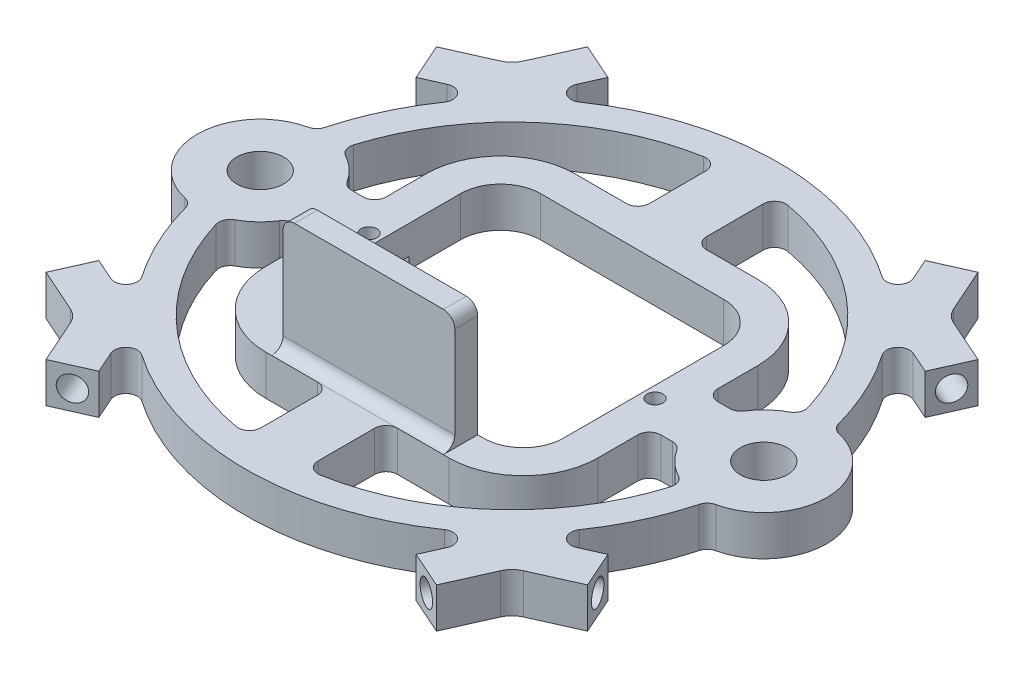
from build123d import *

# Parameters (mm, degrees)
BOSS_EXTRUDE1_DEPTH         = 4.445
SKETCH2_R                   = 5.207
BOSS_EXTRUDE2_DEPTH         = 4.445
BOSS_EXTRUDE3_DEPTH         = 4.445
BOSS_EXTRUDE4_DEPTH         = 4.445
FILLET1_R                   = 2.54
CUT_EXTRUDE1_DEPTH          = 2.54
CUT_EXTRUDE2_REACH          = 93.689
SKETCH7_R                   = 1.7526
SKETCH8_W                   = 38.1
SKETCH8_H                   = 5.08
EXTRUDE_THIN1_DEPTH         = 25.4
FILLET2_R                   = 2.54
BOSS_EXTRUDE6_DEPTH         = 8.89
SKETCH14_R                  = 2.7305
CUT_EXTRUDE3_DEPTH          = 10.16
FILLET3_R                   = 5.08
CIRPATTERN1_COUNT           = 4
CIRPATTERN1_COPY_1_SKETCH_R = 2.7305
CIRPATTERN1_COPY_1_DEPTH    = 10.16
CIRPATTERN1_COPY_2_SKETCH_R = 2.7305
CIRPATTERN1_COPY_2_DEPTH    = 10.16
CIRPATTERN1_COPY_3_SKETCH_R = 2.7305
CIRPATTERN1_COPY_3_DEPTH    = 10.16
FILLET3_OF_CIRPATTERN1_R    = 5.08


with BuildPart() as part:
    # Sketch1 → Boss-Extrude1 (new, symmetric)
    with BuildSketch(Plane(origin=(0, 0, 0), x_dir=(1, 0, 0), z_dir=(0, 1, 0))):
        with BuildLine():
            Line((-20.32, 34.29), (20.32, 34.29))
            ThreePointArc((20.32, 34.29), (31.994332957, 29.454332957), (36.83, 17.78))
            Line((36.83, 17.78), (36.83, -17.78))
            ThreePointArc((36.83, -17.78), (31.994332957, -29.454332957), (20.32, -34.29))
            Line((20.32, -34.29), (-20.32, -34.29))
            ThreePointArc((-20.32, -34.29), (-31.994332957, -29.454332957), (-36.83, -17.78))
            Line((-36.83, -17.78), (-36.83, 17.78))
            ThreePointArc((-36.83, 17.78), (-31.994332957, 29.454332957), (-20.32, 34.29))
        make_face()
        with BuildLine():
            Line((-20.32, 26.67), (20.32, 26.67))
            ThreePointArc((20.32, 26.67), (26.606179285, 24.066179285), (29.21, 17.78))
            Line((29.21, 17.78), (29.21, -17.78))
            ThreePointArc((29.21, -17.78), (26.606179285, -24.066179285), (20.32, -26.67))
            Line((20.32, -26.67), (-20.32, -26.67))
            ThreePointArc((-20.32, -26.67), (-26.606179285, -24.066179285), (-29.21, -17.78))
            Line((-29.21, -17.78), (-29.21, 17.78))
            ThreePointArc((-29.21, 17.78), (-26.606179285, 24.066179285), (-20.32, 26.67))
        make_face(mode=Mode.SUBTRACT)
    extrude(amount=BOSS_EXTRUDE1_DEPTH, both=True)

    # Sketch2 → Boss-Extrude2 (add, symmetric)
    with BuildSketch(Plane(origin=(0, 0, 0), x_dir=(1, 0, 0), z_dir=(0, 1, 0))):
        with BuildLine():
            Line((-43.436592107, 6.35), (-36.83, 6.35))
            Line((-36.83, 6.35), (-36.83, -6.35))
            Line((-36.83, -6.35), (-43.436592107, -6.35))
            ThreePointArc((-43.436592107, -6.35), (-69.85, 0), (-43.436592107, 6.35))
        make_face()
        with Locations(Location((-55.88, 0, 0), (0, 0, 270))):
            Circle(SKETCH2_R, mode=Mode.SUBTRACT)
    boss_extrude2 = extrude(amount=BOSS_EXTRUDE2_DEPTH, both=True)

    # Mirror1: Boss-Extrude2 across plane
    add(boss_extrude2.mirror(Plane(origin=(0, 0, 0), x_dir=(0, 0, 1), z_dir=(1, 0, 0))))

    # Sketch3 → Boss-Extrude3 (add, symmetric)
    with BuildSketch(Plane(origin=(0, 0, 0), x_dir=(1, 0, 0), z_dir=(0, 1, 0))):
        with BuildLine():
            ThreePointArc((51.048948864, -13.10808319), (54.178749787, -13.866024943), (57.398948864, -13.887177336))
            ThreePointArc((57.398948864, -13.887177336), (0, -59.055), (-57.398948864, -13.887177336))
            ThreePointArc((-57.398948864, -13.887177336), (-54.178749787, -13.866024943), (-51.048948864, -13.10808319))
            ThreePointArc((-51.048948864, -13.10808319), (0, -52.705), (51.048948864, -13.10808319))
        make_face()
        with BuildLine():
            ThreePointArc((-51.048948864, 13.10808319), (-54.178749787, 13.866024943), (-57.398948864, 13.887177336))
            ThreePointArc((-57.398948864, 13.887177336), (0, 59.055), (57.398948864, 13.887177336))
            ThreePointArc((57.398948864, 13.887177336), (54.178749787, 13.866024943), (51.048948864, 13.10808319))
            ThreePointArc((51.048948864, 13.10808319), (0, 52.705), (-51.048948864, 13.10808319))
        make_face()
    extrude(amount=BOSS_EXTRUDE3_DEPTH, both=True)

    # Sketch5 → Boss-Extrude4 (add, symmetric)
    with BuildSketch(Plane(origin=(0, 0, 0), x_dir=(1, 0, 0), z_dir=(0, 1, 0))):
        with BuildLine():
            Line((-6.35, 52.32107152), (-6.35, 34.29))
            Line((-6.35, 34.29), (6.35, 34.29))
            Line((6.35, 34.29), (6.35, 52.32107152))
            ThreePointArc((6.35, 52.32107152), (0, 52.705), (-6.35, 52.32107152))
        make_face()
        with BuildLine():
            Line((-6.35, -52.32107152), (-6.35, -34.29))
            Line((-6.35, -34.29), (6.35, -34.29))
            Line((6.35, -34.29), (6.35, -52.32107152))
            ThreePointArc((6.35, -52.32107152), (0, -52.705), (-6.35, -52.32107152))
        make_face()
    extrude(amount=BOSS_EXTRUDE4_DEPTH, both=True)

    # Fillet1
    fillet1_edges = [part.edges().sort_by_distance(p)[0] for p in [
        (-51.048948864, 0, -13.10808319),
        (51.048948864, 0, -13.10808319),
        (57.398948864, 0, -13.887177336),
        (-57.398948864, 0, -13.887177336),
        (6.35, 0, -52.32107152),
        (-6.35, 0, -52.32107152),
        (-6.35, 0, -34.29),
        (6.35, 0, -34.29),
        (-6.35, 0, 52.32107152),
        (6.35, 0, 52.32107152),
        (6.35, 0, 34.29),
        (-6.35, 0, 34.29),
        (-43.436592107, 0, -6.35),
        (-43.436592107, 0, 6.35),
        (-36.83, 0, 6.35),
        (-36.83, 0, -6.35),
        (43.436592107, 0, 6.35),
        (43.436592107, 0, -6.35),
        (36.83, 0, -6.35),
        (36.83, 0, 6.35),
        (-57.398948864, 0, 13.887177336),
        (57.398948864, 0, 13.887177336),
        (51.048948864, 0, 13.10808319),
        (-51.048948864, 0, 13.10808319),
    ]]
    fillet(fillet1_edges, radius=FILLET1_R)

    # Sketch6 → Cut-Extrude1 (cut)
    with BuildSketch(Plane.XZ.offset(4.445)):
        with BuildLine():
            Line((-27.94, -6.35), (-27.94, 6.35))
            Line((-27.94, 6.35), (-31.75, 6.35))
            ThreePointArc((-31.75, 6.35), (-35.342102448, 4.862102448), (-36.83, 1.27))
            Line((-36.83, 1.27), (-36.83, -1.27))
            ThreePointArc((-36.83, -1.27), (-35.342102448, -4.862102448), (-31.75, -6.35))
            Line((-31.75, -6.35), (-27.94, -6.35))
        make_face()
        with BuildLine():
            Line((27.94, 6.35), (31.75, 6.35))
            ThreePointArc((31.75, 6.35), (35.342102448, 4.862102448), (36.83, 1.27))
            Line((36.83, 1.27), (36.83, -1.27))
            ThreePointArc((36.83, -1.27), (35.342102448, -4.862102448), (31.75, -6.35))
            Line((31.75, -6.35), (27.94, -6.35))
            Line((27.94, -6.35), (27.94, 6.35))
        make_face()
    extrude(amount=-CUT_EXTRUDE1_DEPTH, mode=Mode.SUBTRACT)

    # Sketch7 → Cut-Extrude2 (cut, up to next)
    with BuildSketch(Plane.XZ.offset(1.905), mode=Mode.PRIVATE) as cut_extrude2_sk1:
        with Locations(Location((-31.75, 0, 0), (0, 0, 270))):
            Circle(SKETCH7_R)
    cut_extrude2_tool1 = extrude(cut_extrude2_sk1.sketch, amount=-CUT_EXTRUDE2_REACH, mode=Mode.PRIVATE) & part.part
    # Sketch7 → Cut-Extrude2 (cut, up to next)
    with BuildSketch(Plane.XZ.offset(1.905), mode=Mode.PRIVATE) as cut_extrude2_sk2:
        with Locations(Location((31.75, 0, 0), (0, 0, 270))):
            Circle(SKETCH7_R)
    cut_extrude2_tool2 = extrude(cut_extrude2_sk2.sketch, amount=-CUT_EXTRUDE2_REACH, mode=Mode.PRIVATE) & part.part
    add(cut_extrude2_tool1.solids().sort_by_distance((-31.75, -1.905, 0))[0], mode=Mode.SUBTRACT)
    add(cut_extrude2_tool2.solids().sort_by_distance((31.75, -1.905, 0))[0], mode=Mode.SUBTRACT)

    # Sketch8 → Extrude-Thin1 (add)
    with BuildSketch(Plane(origin=(0, 4.445, 0), x_dir=(1, 0, 0), z_dir=(0, 1, 0))):
        with Locations((0, -29.21)):
            Rectangle(SKETCH8_W, SKETCH8_H)
    extrude(amount=EXTRUDE_THIN1_DEPTH)

    # Fillet2
    fillet2_edges = [part.edges().sort_by_distance(p)[0] for p in [
        (0, 4.445, 31.75),
        (19.05, 29.845, 29.21),
        (-19.05, 29.845, 29.21),
    ]]
    fillet(fillet2_edges, radius=FILLET2_R - 0.0001)  # a hair under: the kernel refuses the full size

    # Sketch12 → Boss-Extrude6 (add)
    with BuildSketch(Plane(origin=(0, 4.445, 0), x_dir=(1, 0, 0), z_dir=(0, 1, 0))):
        with BuildLine():
            Line((51.714417922, -37.325393124), (56.477738988, -35.204625947))
            Line((56.477738988, -35.204625947), (60.093627745, -43.326045066))
            Line((60.093627745, -43.326045066), (48.491600433, -48.491600433))
            Line((48.491600433, -48.491600433), (43.326045066, -60.093627745))
            Line((43.326045066, -60.093627745), (35.204625947, -56.477738988))
            Line((35.204625947, -56.477738988), (37.325393124, -51.714417922))
            ThreePointArc((37.325393124, -51.714417922), (36.626905894, -48.726573811), (33.56148376, -48.591355536))
            Line((33.56148376, -48.591355536), (31.765432536, -46.795304312))
            Line((31.765432536, -46.795304312), (46.795304312, -31.765432536))
            Line((46.795304312, -31.765432536), (48.591355536, -33.56148376))
            ThreePointArc((48.591355536, -33.56148376), (48.726573811, -36.626905894), (51.714417922, -37.325393124))
        make_face()
    boss_extrude6 = extrude(amount=-BOSS_EXTRUDE6_DEPTH)

    # Sketch14 → Cut-Extrude3 (cut)
    with BuildSketch(Plane(origin=(-15.161503122, 0, 34.053293559), x_dir=(0.9135454576426028, 0, 0.4067366430757963), z_dir=(-0.4067366430757963, 0, 0.9135454576426028))):
        with Locations((59.577592087, 0)):
            Circle(SKETCH14_R)
    cut_extrude3 = extrude(amount=-CUT_EXTRUDE3_DEPTH, mode=Mode.SUBTRACT)

    # Mirror2: Cut-Extrude3 across plane
    add(cut_extrude3.mirror(Plane(origin=(0, 0, 0), x_dir=(0.7071067811865465, 0, 0.7071067811865486), z_dir=(-0.7071067811865488, 0, 0.7071067811865464))), mode=Mode.SUBTRACT)

    # Fillet3
    fillet3_edges = [part.edges().sort_by_distance(p)[0] for p in [
        (48.491600433, 0, 48.491600433),
    ]]
    fillet(fillet3_edges, radius=FILLET3_R)

    # CirPattern1: Boss-Extrude6, Cut-Extrude3 ×4 about axis
    cirpattern1_axis = Axis((0, 0, 0), (0, 1, 0))
    add([boss_extrude6.rotate(cirpattern1_axis, i * 360 / CIRPATTERN1_COUNT) for i in range(1, CIRPATTERN1_COUNT)])
    add([cut_extrude3.rotate(cirpattern1_axis, i * 360 / CIRPATTERN1_COUNT) for i in range(1, CIRPATTERN1_COUNT)], mode=Mode.SUBTRACT)

    # CirPattern1 copy 1 sketch → CirPattern1 copy 1 (cut)
    with BuildSketch(Plane(origin=(-15.161503122, 0, -34.053293559), x_dir=(0.9135454576426043, 0, -0.40673664307579316), z_dir=(-0.4067366430757933, 0, -0.9135454576426044))):
        with Locations((59.577592087, 0)):
            Circle(CIRPATTERN1_COPY_1_SKETCH_R)
    extrude(amount=-CIRPATTERN1_COPY_1_DEPTH, mode=Mode.SUBTRACT)

    # CirPattern1 copy 2 sketch → CirPattern1 copy 2 (cut)
    with BuildSketch(Plane(origin=(-34.053293559, 0, 15.161503122), x_dir=(-0.4067366430757931, 0, -0.9135454576426044), z_dir=(-0.9135454576426044, 0, 0.40673664307579327))):
        with Locations((59.577592087, 0)):
            Circle(CIRPATTERN1_COPY_2_SKETCH_R)
    extrude(amount=-CIRPATTERN1_COPY_2_DEPTH, mode=Mode.SUBTRACT)

    # CirPattern1 copy 3 sketch → CirPattern1 copy 3 (cut)
    with BuildSketch(Plane(origin=(15.161503122, 0, 34.053293559), x_dir=(-0.9135454576426044, 0, 0.40673664307579305), z_dir=(0.4067366430757932, 0, 0.9135454576426045))):
        with Locations((59.577592087, 0)):
            Circle(CIRPATTERN1_COPY_3_SKETCH_R)
    extrude(amount=-CIRPATTERN1_COPY_3_DEPTH, mode=Mode.SUBTRACT)

    # Fillet3 of CirPattern1
    fillet3_of_cirpattern1_edges = [part.edges().sort_by_distance(p)[0] for p in [
        (48.491600433, 0, -48.491600433),
        (-48.491600433, 0, -48.491600433),
        (-48.491600433, 0, 48.491600433),
    ]]
    fillet(fillet3_of_cirpattern1_edges, radius=FILLET3_OF_CIRPATTERN1_R)


solid = part.part
